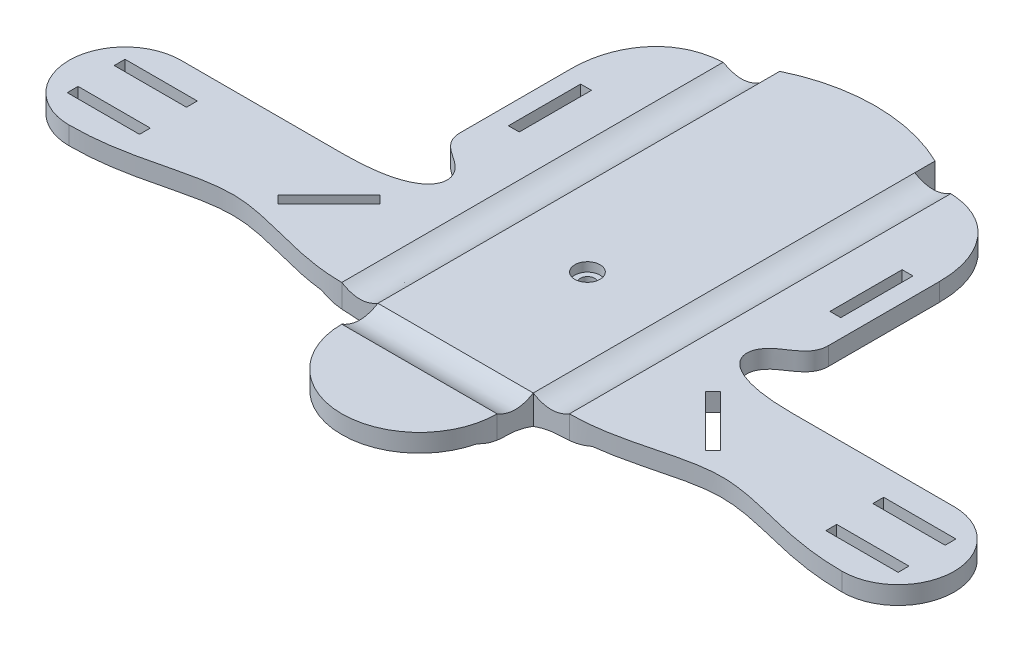
from build123d import *

# Parameters (mm, degrees)
SANDAL_DESIGN_W         = 20
SANDAL_DESIGN_H         = 3
SANDAL_DESIGN_W_2       = 3
SANDAL_DESIGN_H_2       = 20
BOSS_EXTRUDE1_DEPTH     = 8
BOSS_EXTRUDE2_DEPTH     = 2.5
CUT_EXTRUDE3_REACH      = 204.072
SKETCH6_R               = 2
SKETCH7_R               = 3.5
CUT_EXTRUDE4_DEPTH      = 2.5
CUT_EXTRUDE5_DEPTH      = 202.957076727
CUT_EXTRUDE5_DEPTH_BACK = 202.957076727
CUT_EXTRUDE6_DEPTH      = 202.957076669
CUT_EXTRUDE6_DEPTH_BACK = 202.957076669


with BuildPart() as part:
    # Sandal Design → Boss-Extrude1 (new body)
    with BuildSketch(Plane(origin=(0, 0, 0), x_dir=(1, 0, 0), z_dir=(0, 1, 0))):
        with BuildLine():
            Line((12.5, 105.618176015), (21, 105.618176015))
            Line((21, 105.618176015), (21, 111.2308341))
            ThreePointArc((21, 111.2308341), (42.5, 116.179433559), (64, 111.2308341))
            Line((64, 111.2308341), (64, 105.618176015))
            Line((64, 105.618176015), (72.5, 105.618176015))
            add(Edge.make_bspline(
                [(93.5, 82.999999948), (93.5, 91.196820649), (88.204207077, 102.224600535), (77.563477886, 105.618176015), (72.5, 105.618176015)],
                knots=[0, 0, 0, 0, 0.612935635, 1, 1, 1, 1], degree=3))
            Line((93.5, 82.999999948), (93.5, 52.191849548))
            add(Edge.make_bspline(
                [(93.5, 52.191849548), (93.5, 47.540394127), (80.104553071, 43.201826505), (83.23130825, 31.001751884), (104.5, 31.001751884)],
                knots=[0, 0, 0, 0, 0.331226387, 1, 1, 1, 1], degree=3))
            Line((104.5, 31.001751884), (149.5, 31.001751884))
            ThreePointArc((149.5, 31.001751884), (165, 15.501651435), (149.499799102, 0.001751885))
            add(Edge.make_bspline(
                [(74, 0), (87.494084825, 0), (111.347806875, 12.069263412), (131.926415328, 0.001979657), (149.499799102, 0.001751885)],
                knots=[0, 0, 0, 0, 0.462855682, 1, 1, 1, 1], degree=3))
            Line((74, 0), (64, 0))
            Line((64, 0), (64, -10))
            ThreePointArc((64, -10), (42.5, -31.5), (21, -10))
            Line((21, -10), (21, 0))
            Line((21, 0), (11, 0))
            add(Edge.make_bspline(
                [(11, 0), (-2.494084825, 0), (-26.347806875, 12.069263412), (-46.926415328, 0.001979657), (-64.499799102, 0.001751885)],
                knots=[0, 0, 0, 0, 0.462855682, 1, 1, 1, 1], degree=3))
            ThreePointArc((-64.499799102, 0.001751885), (-80, 15.501651435), (-64.5, 31.001751884))
            Line((-64.5, 31.001751884), (-19.5, 31.001751884))
            add(Edge.make_bspline(
                [(-8.5, 52.191849548), (-8.5, 47.540394127), (4.895446929, 43.201826505), (1.76869175, 31.001751884), (-19.5, 31.001751884)],
                knots=[0, 0, 0, 0, 0.331226387, 1, 1, 1, 1], degree=3))
            Line((-8.5, 52.191849548), (-8.5, 82.999999948))
            add(Edge.make_bspline(
                [(-8.5, 82.999999948), (-8.5, 91.196820649), (-3.204207077, 102.224600535), (7.436522114, 105.618176015), (12.5, 105.618176015)],
                knots=[0, 0, 0, 0, 0.612935635, 1, 1, 1, 1], degree=3))
        make_face()
        Polygon((101.642135624, 10), (103.763455967, 12.121320344), (89.621320344, 26.263455967), (87.5, 24.142135624), align=None, mode=Mode.SUBTRACT)
        Polygon((157.5, 23.501751884), (137.5, 23.501751884), (137.5, 20.501751884), (157.5, 20.501751885), align=None, mode=Mode.SUBTRACT)
        with Locations((147.5, 9.001751885)):
            Rectangle(SANDAL_DESIGN_W, SANDAL_DESIGN_H, mode=Mode.SUBTRACT)
        Polygon((-4.621320344, 26.263455967), (-2.5, 24.142135624), (-16.642135624, 10), (-18.763455967, 12.121320344), align=None, mode=Mode.SUBTRACT)
        Polygon((-52.5, 23.501751884), (-52.5, 20.501751884), (-72.5, 20.501751885), (-72.5, 23.501751884), align=None, mode=Mode.SUBTRACT)
        with Locations((-62.5, 9.001751885)):
            Rectangle(SANDAL_DESIGN_W, SANDAL_DESIGN_H, mode=Mode.SUBTRACT)
        with Locations((-2, 70.618176015)):
            Rectangle(SANDAL_DESIGN_W_2, SANDAL_DESIGN_H_2, mode=Mode.SUBTRACT)
        with Locations((87, 70.618176015)):
            Rectangle(SANDAL_DESIGN_W_2, SANDAL_DESIGN_H_2, mode=Mode.SUBTRACT)
    extrude(amount=BOSS_EXTRUDE1_DEPTH)

    # Sketch4 → Boss-Extrude2 (add)
    with BuildSketch(Plane.XZ):
        with BuildLine():
            Line((64, -15.577524047), (64, -57.422475953))
            ThreePointArc((64, -57.422475953), (42.5, -66.5), (21, -57.422475953))
            Line((21, -57.422475953), (21, -15.577524047))
            ThreePointArc((21, -15.577524047), (42.5, -6.5), (64, -15.577524047))
        make_face()
    extrude(amount=BOSS_EXTRUDE2_DEPTH)

    # Sketch6 → Cut-Extrude3 (cut, up to next)
    with BuildSketch(Plane.XZ.offset(2.5), mode=Mode.PRIVATE) as cut_extrude3_sk1:
        with Locations((42.5, -36.5)):
            Circle(SKETCH6_R)
    cut_extrude3_tool1 = extrude(cut_extrude3_sk1.sketch, amount=-CUT_EXTRUDE3_REACH, mode=Mode.PRIVATE) & part.part
    add(cut_extrude3_tool1.solids().sort_by_distance((42.5, -2.5, -36.5))[0], mode=Mode.SUBTRACT)

    # Sketch7 → Cut-Extrude4 (cut)
    with BuildSketch(Plane(origin=(0, 8, 0), x_dir=(1, 0, 0), z_dir=(0, 1, 0))):
        with Locations((42.5, 36.5)):
            Circle(SKETCH7_R)
    extrude(amount=-CUT_EXTRUDE4_DEPTH, mode=Mode.SUBTRACT)

    # Sketch8 → Cut-Extrude5 (cut, two sides: drawn at the far end of the back side and taken through both)
    with BuildSketch(Plane.XY.offset(-CUT_EXTRUDE5_DEPTH_BACK)):
        with BuildLine():
            Line((-80, 3), (-80, 0))
            Line((-80, 0), (21, 0))
            add(Edge.make_bspline(
                [(21, 0), (18.333333333, 1), (15.666666667, 1.5), (10.333333332, 1.5), (7.666665837, 2), (5, 3)],
                knots=[0, 0, 0, 0, 0.5, 0.5, 1, 1, 1, 1], degree=3))
            Line((5, 3), (-80, 3))
        make_face()
        with BuildLine():
            Line((21, 8), (11, 8))
            add(Edge.make_bspline(
                [(11, 8), (16, 5), (21, 8)],
                knots=[0, 0, 0, 1, 1, 1], degree=2))
        make_face()
        with BuildLine():
            Line((165, 0), (165, 3))
            Line((165, 3), (80, 3))
            add(Edge.make_bspline(
                [(80, 3), (77.333334155, 2), (74.666666668, 1.5), (69.333333333, 1.5), (66.666666664, 0.999999999), (64, 0)],
                knots=[0, 0, 0, 0, 0.5, 0.5, 1, 1, 1, 1], degree=3))
            Line((64, 0), (165, 0))
        make_face()
        with BuildLine():
            add(Edge.make_bspline(
                [(74, 8), (69, 5), (64, 8)],
                knots=[0, 0, 0, 1, 1, 1], degree=2))
            Line((74, 8), (64, 8))
        make_face()
    extrude(amount=CUT_EXTRUDE5_DEPTH + CUT_EXTRUDE5_DEPTH_BACK, mode=Mode.SUBTRACT)

    # Sketch9 → Cut-Extrude6 (cut, two sides: drawn at the far end of the back side and taken through both)
    with BuildSketch(Plane(origin=(0, 0, 0), x_dir=(0, 0, -1), z_dir=(1, 0, 0)).offset(-CUT_EXTRUDE6_DEPTH_BACK)):
        with BuildLine():
            Line((0.001751885, 8), (-10, 8))
            add(Edge.make_bspline(
                [(-10, 8), (-4.999268662, 4.999999923), (0.001751885, 8)],
                knots=[0, 0, 0, 1, 1, 1], degree=2))
        make_face()
        with BuildLine():
            Line((-31.5, 3), (-31.5, 0))
            Line((-31.5, 0), (0, 0))
            add(Edge.make_bspline(
                [(0, 0), (-2.5, 1), (-5, 1.5), (-10, 1.5), (-12.499999995, 2), (-15, 3)],
                knots=[0, 0, 0, 0, 0.5, 0.5, 1, 1, 1, 1], degree=3))
            Line((-15, 3), (-31.5, 3))
        make_face()
    extrude(amount=CUT_EXTRUDE6_DEPTH + CUT_EXTRUDE6_DEPTH_BACK, mode=Mode.SUBTRACT)

    # Sketch12 → Revolve1 (revolve)
    with BuildSketch(Plane(origin=(42.5, 0, 0), x_dir=(0, 0, -1), z_dir=(1, 0, 0))):
        Polygon((34.5, -2.5), (34.5, 0), (15.577524047, 0), (6.5, -2.5), align=None)
    revolve(axis=Axis((42.5, -2.5, -36.5), (0, 1, 0)))


solid = part.part
